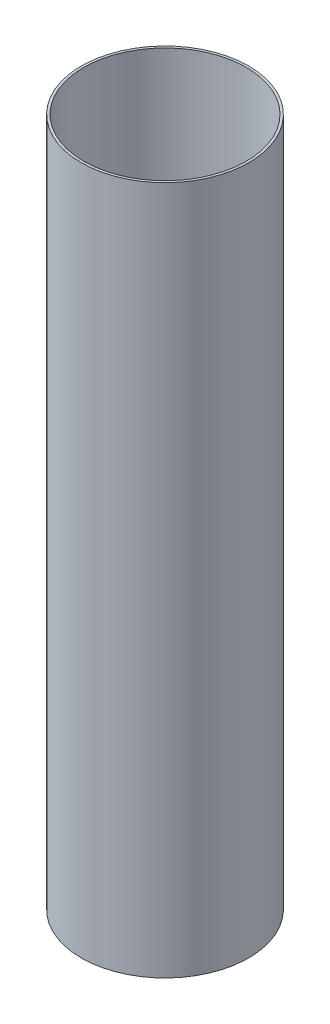
from build123d import *

# Parameters (mm, degrees)
MOTOR_MOUNT_PROFILE_SKETCH_R   = 50.9778
MOTOR_MOUNT_PROFILE_SKETCH_R_2 = 49.53
MOTOR_MOUNT_BODY_DEPTH         = 419.351000006


with BuildPart() as part:
    # Motor Mount Profile Sketch → Motor Mount Body (new body)
    with BuildSketch(Plane(origin=(0, 0, 0), x_dir=(1, 0, 0), z_dir=(0, 1, 0))):
        Circle(MOTOR_MOUNT_PROFILE_SKETCH_R)
        Circle(MOTOR_MOUNT_PROFILE_SKETCH_R_2, mode=Mode.SUBTRACT)
    extrude(amount=MOTOR_MOUNT_BODY_DEPTH)


solid = part.part
